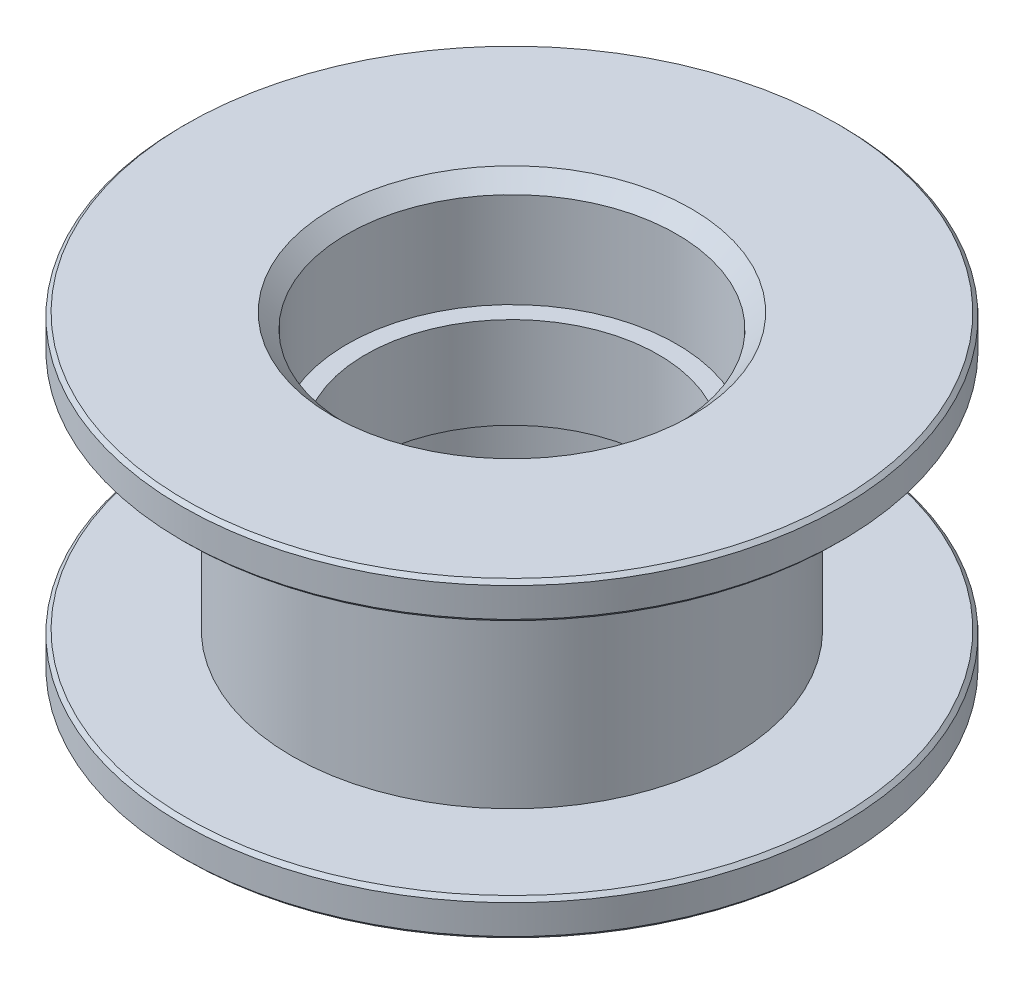
from build123d import *

# Parameters (mm, degrees)
INNERC_SIZE = 0.4
OUTERC_SIZE = 0.1


with BuildPart() as part:
    # BodyS → Body (revolve)
    with BuildSketch(Plane.XY):
        Polygon((6, -3.25), (6, 3.25), (9, 3.25), (9, 4.25), (4.5, 4.25), (4.5, 1.25), (4, 1.25), (4, -1.25), (4.5, -1.25), (4.5, -4.25), (9, -4.25), (9, -3.25), align=None)
    revolve(axis=Axis((0, 4.25, 0), (0, -1, 0)))

    # InnerC
    innerc_edges = [part.edges().sort_by_distance(p)[0] for p in [
        (-4.5, -4.25, 0),
        (-4.5, 4.25, 0),
    ]]
    chamfer(innerc_edges, length=INNERC_SIZE)

    # OuterC
    outerc_edges = [part.edges().sort_by_distance(p)[0] for p in [
        (-9, -4.25, 0),
        (-9, -3.25, 0),
        (-9, 3.25, 0),
        (-9, 4.25, 0),
    ]]
    chamfer(outerc_edges, length=OUTERC_SIZE)


solid = part.part
